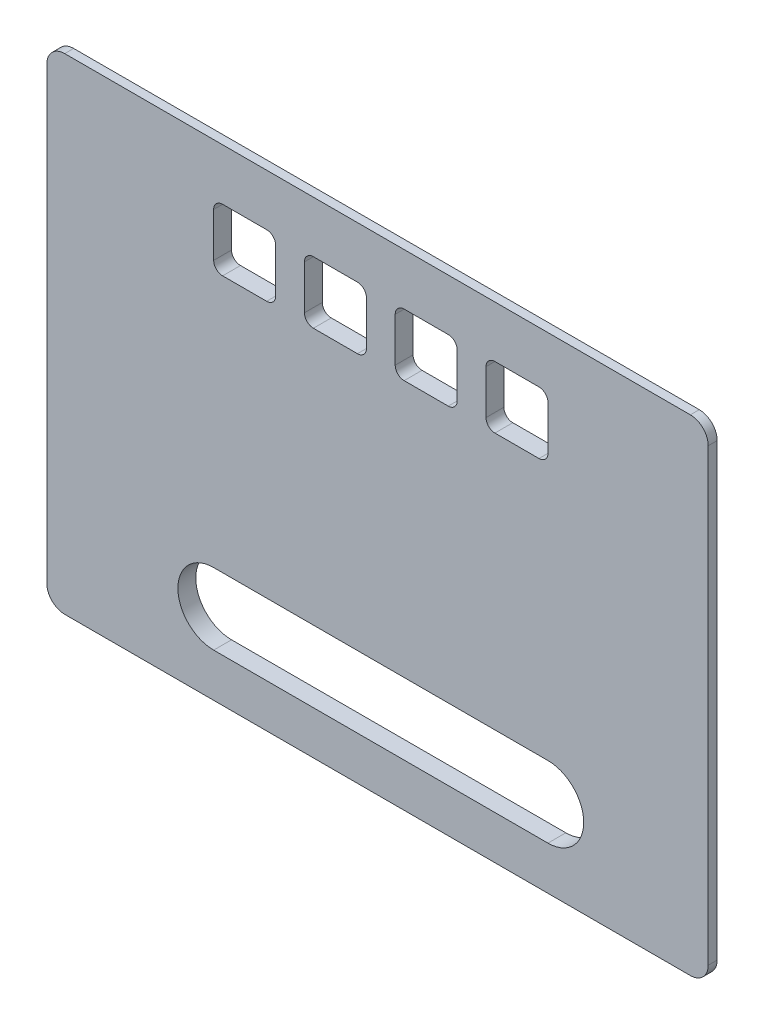
from build123d import *

# Parameters (mm, degrees)
SKETCH_1_W                                     = 105
SKETCH_1_H                                     = 74
EXTRUDE_1_DEPTH                                = 3
EXTRUDE_START                                  = 1.5
SKETCH_2_W                                     = 111
SKETCH_2_H                                     = 80
EXTRUDE_2_DEPTH                                = 1.5
SKETCH_3_W                                     = 10.4
SKETCH_3_H                                     = 10.4
CUT_EXTRUDE_1_DEPTH                            = 5
SKETCH_4_W                                     = 105
SKETCH_4_H                                     = 1.5
TOP_REAR_INNER_EXTENSION_1P5MM_DEPTH           = 3
TOP_REAR_OUTER_SKIN_EXTENSION_1P5MM_START      = 1.5
SKETCH_5_W                                     = 111
SKETCH_5_H                                     = 1.5
TOP_REAR_OUTER_SKIN_EXTENSION_1P5MM_DEPTH      = 1.5
TOOL_D3_R1P5_BUTTON_CORNERS_R                  = 1.5
TOOL_D3_R3_TOP_OUTER_CONTOUR_R                 = 3
SKETCH_6_R                                     = 1.5
TOP_PLANAR_EDGE_SEMICIRCLE_POCKETS_D3_DE_DEPTH = 1.5


with BuildPart() as part:
    # Эскиз1 → Бобышка-Вытянуть1 (new body)
    with BuildSketch(Plane.XY):
        with Locations((53.5, 40)):
            Rectangle(SKETCH_1_W, SKETCH_1_H)
    extrude(amount=EXTRUDE_1_DEPTH)

    # Эскиз2 → Бобышка-Вытянуть2 (add)
    with BuildSketch(Plane.XY.offset(EXTRUDE_START)):
        with Locations((53.5, 40)):
            Rectangle(SKETCH_2_W, SKETCH_2_H)
    extrude(amount=EXTRUDE_2_DEPTH)

    # Эскиз3 → Вырез-Вытянуть1 (cut)
    with BuildSketch(Plane(origin=(0.75, 0, 3), x_dir=(1, 0, 0), z_dir=(0, 0, 1))):
        with Locations((30.45, 67.65)):
            Rectangle(SKETCH_3_W, SKETCH_3_H)
        with Locations((45.683, 67.65)):
            Rectangle(SKETCH_3_W, SKETCH_3_H)
        with Locations((60.917, 67.65)):
            Rectangle(SKETCH_3_W, SKETCH_3_H)
        with Locations((76.15, 67.65)):
            Rectangle(SKETCH_3_W, SKETCH_3_H)
        with BuildLine():
            Line((25.25, 19.3), (81.35, 19.3))
            ThreePointArc((81.35, 19.3), (87.35, 13.3), (81.35, 7.3))
            Line((81.35, 7.3), (25.25, 7.3))
            ThreePointArc((25.25, 7.3), (19.25, 13.3), (25.25, 19.3))
        make_face()
    extrude(amount=-CUT_EXTRUDE_1_DEPTH, mode=Mode.SUBTRACT)

    # Эскиз4 → top_rear_inner_extension_1p5mm (add)
    with BuildSketch(Plane.XY):
        with Locations((53.5, 77.75)):
            Rectangle(SKETCH_4_W, SKETCH_4_H)
    extrude(amount=TOP_REAR_INNER_EXTENSION_1P5MM_DEPTH)

    # Эскиз5 → top_rear_outer_skin_extension_1p5mm (add)
    with BuildSketch(Plane.XY.offset(TOP_REAR_OUTER_SKIN_EXTENSION_1P5MM_START)):
        with Locations((53.5, 80.75)):
            Rectangle(SKETCH_5_W, SKETCH_5_H)
    extrude(amount=TOP_REAR_OUTER_SKIN_EXTENSION_1P5MM_DEPTH)

    # tool_D3_R1p5_button_corners
    tool_d3_r1p5_button_corners_edges = [part.edges().sort_by_distance(p)[0] for p in [
        (71.7, 72.85, 1.5),
        (82.1, 72.85, 1.5),
        (82.1, 62.45, 1.5),
        (71.7, 62.45, 1.5),
        (56.467, 72.85, 1.5),
        (66.867, 72.85, 1.5),
        (66.867, 62.45, 1.5),
        (56.467, 62.45, 1.5),
        (41.233, 72.85, 1.5),
        (51.633, 72.85, 1.5),
        (51.633, 62.45, 1.5),
        (41.233, 62.45, 1.5),
        (26, 62.45, 1.5),
        (36.4, 62.45, 1.5),
        (36.4, 72.85, 1.5),
        (26, 72.85, 1.5),
    ]]
    fillet(tool_d3_r1p5_button_corners_edges, radius=TOOL_D3_R1P5_BUTTON_CORNERS_R)

    # tool_D3_R3_top_outer_contour
    tool_d3_r3_top_outer_contour_edges = [part.edges().sort_by_distance(p)[0] for p in [
        (-2, 81.5, 2.25),
        (109, 81.5, 2.25),
        (109, 0, 2.25),
        (-2, 0, 2.25),
    ]]
    fillet(tool_d3_r3_top_outer_contour_edges, radius=TOOL_D3_R3_TOP_OUTER_CONTOUR_R)

    # Эскиз6 → top_planar_edge_semicircle_pockets_D3_depth1p5_6x (cut)
    with BuildSketch(Plane(origin=(0, 0, 0), x_dir=(-1, 0, 0), z_dir=(0, 0, -1))):
        with Locations((-1, 10)):
            Circle(SKETCH_6_R)
        with Locations((-106, 10)):
            Circle(SKETCH_6_R)
        with Locations((-1, 40.75)):
            Circle(SKETCH_6_R)
        with Locations((-106, 40.75)):
            Circle(SKETCH_6_R)
        with Locations((-1, 71.5)):
            Circle(SKETCH_6_R)
        with Locations((-106, 71.5)):
            Circle(SKETCH_6_R)
    extrude(amount=-TOP_PLANAR_EDGE_SEMICIRCLE_POCKETS_D3_DE_DEPTH, mode=Mode.SUBTRACT)


solid = part.part
